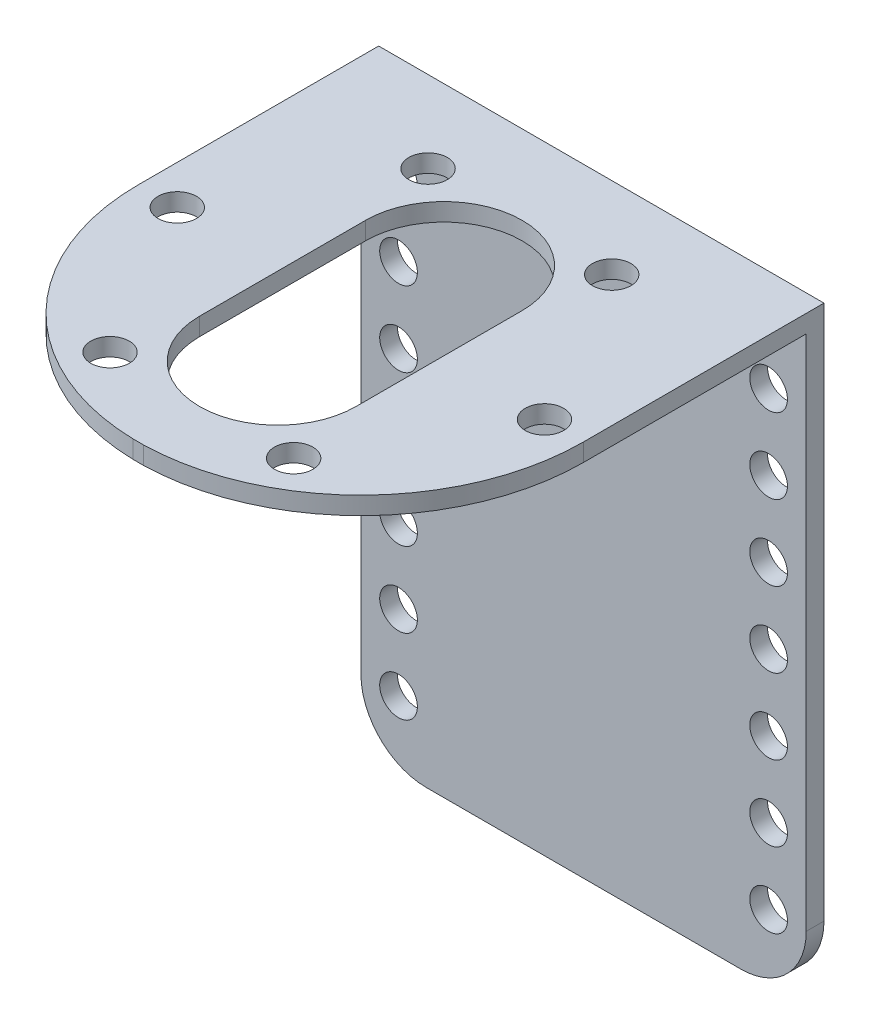
from build123d import *

# Parameters (mm, degrees)
SKETCH1_R           = 1.59
BOSS_EXTRUDE1_DEPTH = 1.5
SKETCH1_3_W         = 37.59
SKETCH1_3_H         = 1.5
BOSS_EXTRUDE2_DEPTH = 39.09
SKETCH2_R           = 1.625
CUT_EXTRUDE1_DEPTH  = 39.09


with BuildPart() as part:
    # Sketch1 → Boss-Extrude1 (new body)
    with BuildSketch(Plane.XY):
        with BuildLine():
            Line((-13.275, -24.6), (13.275, -24.6))
            ThreePointArc((13.275, -24.6), (17.178229432, -22.983229432), (18.795, -19.08))
            Line((18.795, -19.08), (18.795, 24.6))
            Line((18.795, 24.6), (-18.795, 24.6))
            Line((-18.795, 24.6), (-18.795, -19.08))
            ThreePointArc((-18.795, -19.08), (-17.178229432, -22.983229432), (-13.275, -24.6))
        make_face()
        with Locations((-15.62, -19.08)):
            Circle(SKETCH1_R, mode=Mode.SUBTRACT)
        with Locations((-15.62, -12.73)):
            Circle(SKETCH1_R, mode=Mode.SUBTRACT)
        with Locations((-15.62, -6.38)):
            Circle(SKETCH1_R, mode=Mode.SUBTRACT)
        with Locations((-15.62, -0.03)):
            Circle(SKETCH1_R, mode=Mode.SUBTRACT)
        with Locations((15.62, -19.08)):
            Circle(SKETCH1_R, mode=Mode.SUBTRACT)
        with Locations((15.62, -12.73)):
            Circle(SKETCH1_R, mode=Mode.SUBTRACT)
        with Locations((15.62, -6.38)):
            Circle(SKETCH1_R, mode=Mode.SUBTRACT)
        with Locations((15.62, -0.03)):
            Circle(SKETCH1_R, mode=Mode.SUBTRACT)
        with Locations((-15.62, 6.32)):
            Circle(SKETCH1_R, mode=Mode.SUBTRACT)
        with Locations((-15.62, 12.67)):
            Circle(SKETCH1_R, mode=Mode.SUBTRACT)
        with Locations((-15.62, 19.02)):
            Circle(SKETCH1_R, mode=Mode.SUBTRACT)
        with Locations((15.62, 6.32)):
            Circle(SKETCH1_R, mode=Mode.SUBTRACT)
        with Locations((15.62, 12.67)):
            Circle(SKETCH1_R, mode=Mode.SUBTRACT)
        with Locations((15.62, 19.02)):
            Circle(SKETCH1_R, mode=Mode.SUBTRACT)
    extrude(amount=BOSS_EXTRUDE1_DEPTH)

    # Sketch1<3> → Boss-Extrude2 (add)
    with BuildSketch(Plane.XY):
        with Locations((0, 25.35)):
            Rectangle(SKETCH1_3_W, SKETCH1_3_H)
    extrude(amount=BOSS_EXTRUDE2_DEPTH)

    # Sketch2 → Cut-Extrude1 (cut)
    with BuildSketch(Plane(origin=(0, 26.1, 0), x_dir=(1, 0, 0), z_dir=(0, 1, 0))):
        with BuildLine():
            ThreePointArc((-6.605, -27.31), (0, -33.915), (6.605, -27.31))
            Line((6.605, -27.31), (6.605, -13.29))
            ThreePointArc((6.605, -13.29), (0, -6.685), (-6.605, -13.29))
            Line((-6.605, -13.29), (-6.605, -27.31))
        make_face()
        with BuildLine():
            ThreePointArc((-0.433503172, -39.09), (-13.44246475, -33.435911329), (-18.795, -20.3))
            Line((-18.795, -20.3), (-18.795, -39.09))
            Line((-18.795, -39.09), (-0.433503172, -39.09))
        make_face()
        with BuildLine():
            ThreePointArc((18.795, -20.3), (13.44246475, -33.435911329), (0.433503172, -39.09))
            Line((0.433503172, -39.09), (18.795, -39.09))
            Line((18.795, -39.09), (18.795, -20.3))
        make_face()
        with Locations((-15.5, -20.3)):
            Circle(SKETCH2_R)
        with Locations((-7.75, -6.876606241)):
            Circle(SKETCH2_R)
        with Locations((7.75, -6.876606241)):
            Circle(SKETCH2_R)
        with Locations((15.5, -20.3)):
            Circle(SKETCH2_R)
        with Locations((7.75, -33.723393759)):
            Circle(SKETCH2_R)
        with Locations((-7.75, -33.723393759)):
            Circle(SKETCH2_R)
    extrude(amount=-CUT_EXTRUDE1_DEPTH, mode=Mode.SUBTRACT)


solid = part.part
